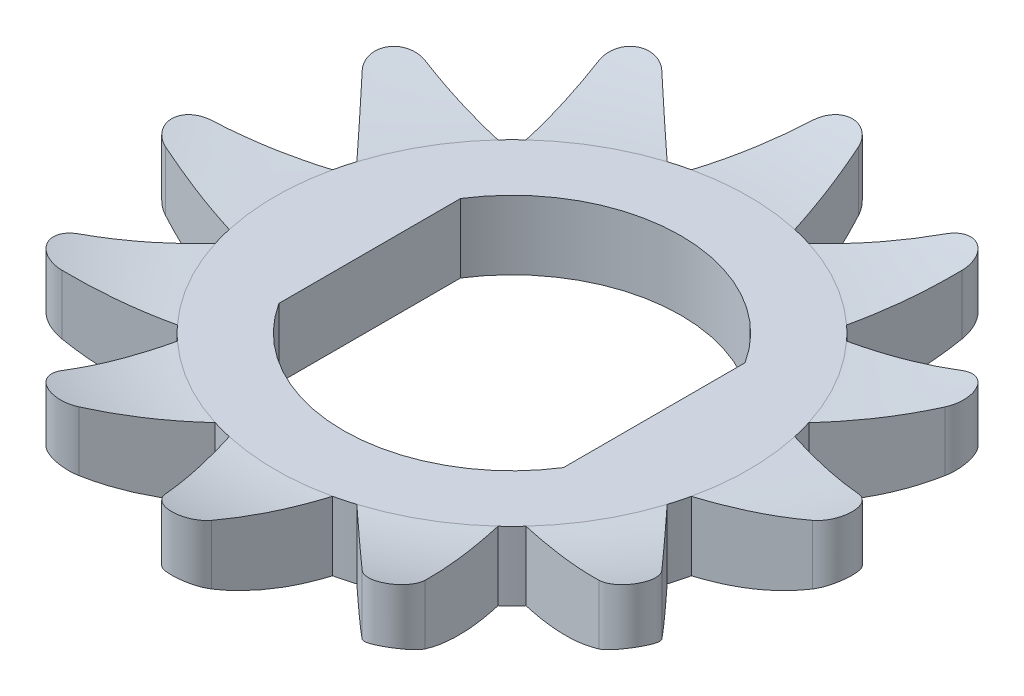
from build123d import *

# Parameters (mm, degrees)
BOSS_EXTRUDE1_DEPTH = 2.45
CUT_EXTRUDE1_DEPTH  = 2.45


with BuildPart() as part:
    # Sketch1 → Boss-Extrude1 (new body)
    with BuildSketch(Plane(origin=(0, 0, 0), x_dir=(1, 0, 0), z_dir=(0, 1, 0))):
        with BuildLine():
            Line((-1.5, 6.70936845), (-0.668522477, 9.387551675))
            ThreePointArc((-0.668522477, 9.387551675), (0, 9.88), (0.668522477, 9.387551675))
            Line((0.668522477, 9.387551675), (1.5, 6.70936845))
            ThreePointArc((1.5, 6.70936845), (1.779380935, 6.640740056), (2.055646119, 6.560483521))
            Line((2.055646119, 6.560483521), (4.114818389, 8.464119468))
            ThreePointArc((4.114818389, 8.464119468), (4.94, 8.556330989), (5.272733285, 7.795596991))
            Line((5.272733285, 7.795596991), (4.653722331, 5.060483521))
            ThreePointArc((4.653722331, 5.060483521), (4.861359121, 4.861359121), (5.060483521, 4.653722331))
            Line((5.060483521, 4.653722331), (7.795596991, 5.272733285))
            ThreePointArc((7.795596991, 5.272733285), (8.556330989, 4.94), (8.464119468, 4.114818389))
            Line((8.464119468, 4.114818389), (6.560483521, 2.055646119))
            ThreePointArc((6.560483521, 2.055646119), (6.640740056, 1.779380935), (6.70936845, 1.5))
            Line((6.70936845, 1.5), (9.387551675, 0.668522477))
            ThreePointArc((9.387551675, 0.668522477), (9.88, 0), (9.387551675, -0.668522477))
            Line((9.387551675, -0.668522477), (6.70936845, -1.5))
            ThreePointArc((6.70936845, -1.5), (6.640740056, -1.779380935), (6.560483521, -2.055646119))
            Line((6.560483521, -2.055646119), (8.464119468, -4.114818389))
            ThreePointArc((8.464119468, -4.114818389), (8.556330989, -4.94), (7.795596991, -5.272733285))
            Line((7.795596991, -5.272733285), (5.060483521, -4.653722331))
            ThreePointArc((5.060483521, -4.653722331), (4.861359121, -4.861359121), (4.653722331, -5.060483521))
            Line((4.653722331, -5.060483521), (5.272733285, -7.795596991))
            ThreePointArc((5.272733285, -7.795596991), (4.94, -8.556330989), (4.114818389, -8.464119468))
            Line((4.114818389, -8.464119468), (2.055646119, -6.560483521))
            ThreePointArc((2.055646119, -6.560483521), (1.779380935, -6.640740056), (1.5, -6.70936845))
            Line((1.5, -6.70936845), (0.668522477, -9.387551675))
            ThreePointArc((0.668522477, -9.387551675), (0, -9.88), (-0.668522477, -9.387551675))
            Line((-0.668522477, -9.387551675), (-1.5, -6.70936845))
            ThreePointArc((-1.5, -6.70936845), (-1.779380935, -6.640740056), (-2.055646119, -6.560483521))
            Line((-2.055646119, -6.560483521), (-4.114818389, -8.464119468))
            ThreePointArc((-4.114818389, -8.464119468), (-4.94, -8.556330989), (-5.272733285, -7.795596991))
            Line((-5.272733285, -7.795596991), (-4.653722331, -5.060483521))
            ThreePointArc((-4.653722331, -5.060483521), (-4.861359121, -4.861359121), (-5.060483521, -4.653722331))
            Line((-5.060483521, -4.653722331), (-7.795596991, -5.272733285))
            ThreePointArc((-7.795596991, -5.272733285), (-8.556330989, -4.94), (-8.464119468, -4.114818389))
            Line((-8.464119468, -4.114818389), (-6.560483521, -2.055646119))
            ThreePointArc((-6.560483521, -2.055646119), (-6.640740056, -1.779380935), (-6.70936845, -1.5))
            Line((-6.70936845, -1.5), (-9.387551675, -0.668522477))
            ThreePointArc((-9.387551675, -0.668522477), (-9.88, 0), (-9.387551675, 0.668522477))
            Line((-9.387551675, 0.668522477), (-6.70936845, 1.5))
            ThreePointArc((-6.70936845, 1.5), (-6.640740056, 1.779380935), (-6.560483521, 2.055646119))
            Line((-6.560483521, 2.055646119), (-8.464119468, 4.114818389))
            ThreePointArc((-8.464119468, 4.114818389), (-8.556330989, 4.94), (-7.795596991, 5.272733285))
            Line((-7.795596991, 5.272733285), (-5.060483521, 4.653722331))
            ThreePointArc((-5.060483521, 4.653722331), (-4.861359121, 4.861359121), (-4.653722331, 5.060483521))
            Line((-4.653722331, 5.060483521), (-5.272733285, 7.795596991))
            ThreePointArc((-5.272733285, 7.795596991), (-4.94, 8.556330989), (-4.114818389, 8.464119468))
            Line((-4.114818389, 8.464119468), (-2.055646119, 6.560483521))
            ThreePointArc((-2.055646119, 6.560483521), (-1.779380935, 6.640740056), (-1.5, 6.70936845))
        make_face()
    extrude(amount=BOSS_EXTRUDE1_DEPTH)

    # Sketch2 → Cut-Revolve1 (revolve, cut)
    with BuildSketch(Plane(origin=(0, 0, 0), x_dir=(0, 0, -1), z_dir=(1, 0, 0))):
        with BuildLine():
            ThreePointArc((-6.875, 0), (-8.436451648, 0.216588585), (-9.88, 0.85))
            Line((-9.88, 0.85), (-9.88, 0))
            Line((-9.88, 0), (-6.875, 0))
        make_face()
        with BuildLine():
            Line((0, 2.45), (-9.88, 2.45))
            ThreePointArc((-9.88, 2.45), (-8.394253517, 2.113123734), (-6.875, 2))
            Line((-6.875, 2), (0, 2))
            Line((0, 2), (0, 2.45))
        make_face()
    revolve(axis=Axis((0, 0, 0), (0, 1, 0)), mode=Mode.SUBTRACT)

    # Sketch3 → Cut-Extrude1 (cut)
    with BuildSketch(Plane(origin=(0, 2, 0), x_dir=(1, 0, 0), z_dir=(0, 1, 0))):
        with BuildLine():
            Line((-4.13, -2.636873148), (-4.13, 2.636873148))
            ThreePointArc((-4.13, 2.636873148), (0, 4.9), (4.13, 2.636873148))
            Line((4.13, 2.636873148), (4.13, -2.636873148))
            ThreePointArc((4.13, -2.636873148), (0, -4.9), (-4.13, -2.636873148))
        make_face()
    extrude(amount=-CUT_EXTRUDE1_DEPTH, mode=Mode.SUBTRACT)


solid = part.part
